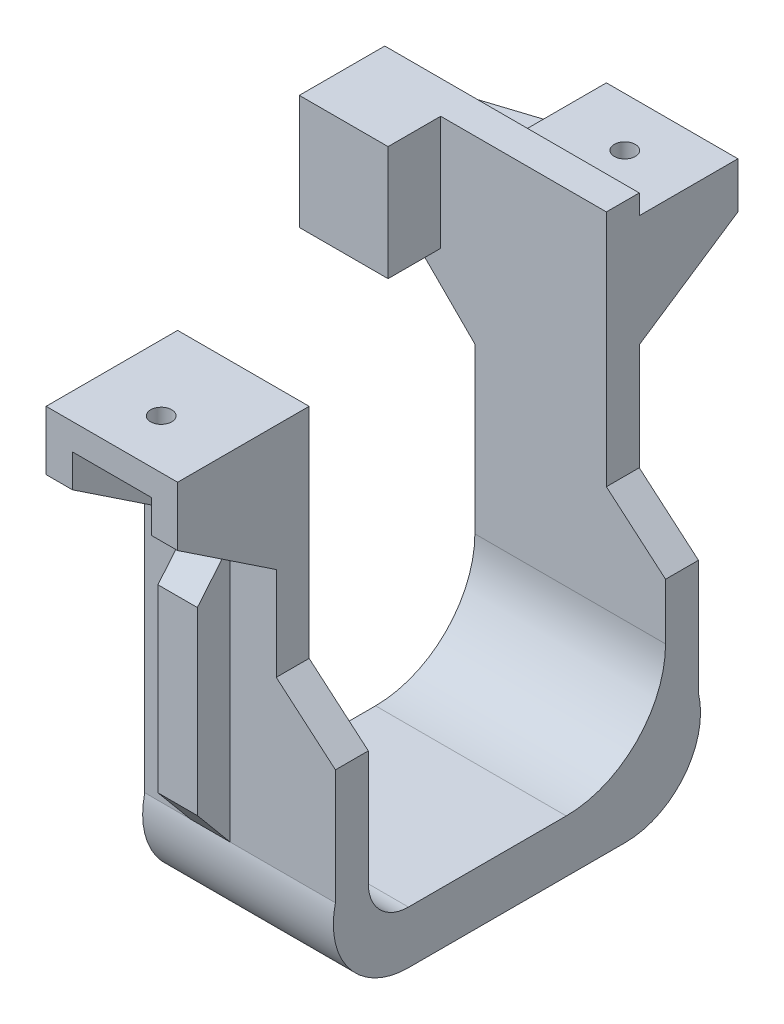
from build123d import *
from OCP.BRepFilletAPI import BRepFilletAPI_MakeChamfer

# Parameters (mm, degrees)
RESSALTO_EXTRUS_O1_DEPTH = 5
RESSALTO_EXTRUS_O2_DEPTH = 29
CORTE_EXTRUS_O1_REACH    = 89.714
RESSALTO_EXTRUS_O3_DEPTH = 5
ESBO_O5_W                = 13.5
ESBO_O5_H                = 17.397720337
RESSALTO_EXTRUS_O4_DEPTH = 8
RESSALTO_EXTRUS_O5_DEPTH = 20
ESBO_O7_W                = 11.5
ESBO_O7_H                = 13
CORTE_EXTRUS_O2_DEPTH    = 20
RESSALTO_EXTRUS_O6_DEPTH = 20
ESBO_O9_W                = 12
ESBO_O9_H                = 15
CORTE_EXTRUS_O3_DEPTH    = 20
ESBO_O11_W               = 6
ESBO_O11_H               = 39.4
RESSALTO_EXTRUS_O7_DEPTH = 5
ESBO_O12_W               = 6
ESBO_O12_H               = 41.397720337
RESSALTO_EXTRUS_O8_DEPTH = 5
CHANFRO1_SIZE            = 5
CHANFRO1_SIZE_2          = 6
RESSALTO_EXTRUS_O9_START = -5.7
RESSALTO_EXTRUS_O9_DEPTH = 6
ESBO_O14_R               = 1.6
CORTE_EXTRUS_O4_DEPTH    = 6


with BuildPart() as part:
    # Esboço1 → Ressalto-extrusão1 (new body)
    with BuildSketch(Plane.XY):
        Polygon((0, 0), (0, 58.4), (20, 58.4), (20, 25.2), (29, 17.52), (29, 0), align=None)
    extrude(amount=RESSALTO_EXTRUS_O1_DEPTH)

    # Esboço2 → Ressalto-extrusão2 (add)
    with BuildSketch(Plane.ZY):
        with BuildLine():
            Line((0, 0), (5, 0))
            ThreePointArc((5, 0), (2.871117767, -9.744454942), (-6.101940178, -14.1))
            Line((-6.101940178, -14.1), (-39.10228157, -14.1))
            ThreePointArc((-39.10228157, -14.1), (-48.076340899, -9.74361665), (-50.204561234, 0.002279663))
            Line((-50.204561234, 0.002279663), (-50.204561234, 61.4))
            Line((-50.204561234, 61.4), (-45.204561234, 61.4))
            Line((-45.204561234, 61.4), (-45.204561234, 9.002278982))
            ThreePointArc((-45.204561234, 9.002278982), (-40.78120589, -1.676645138), (-30.10228157, -6.1))
            Line((-30.10228157, -6.1), (-6.102283186, -6.1))
            ThreePointArc((-6.102283186, -6.1), (-1.788124517, -4.313489814), (0, 0))
        make_face()
    extrude(amount=-RESSALTO_EXTRUS_O2_DEPTH)

    # Esboço3 → Corte-extrusão1 (cut, up to next)
    with BuildSketch(Plane(origin=(0, 0, -50.204561234), x_dir=(-1, 0, 0), z_dir=(0, 0, -1)), mode=Mode.PRIVATE) as corte_extrus_o1_sk1:
        Polygon((-29, 17.52), (-20, 25.201139832), (-20, 61.4), (-29, 61.4), align=None)
    corte_extrus_o1_tool1 = extrude(corte_extrus_o1_sk1.sketch, amount=-CORTE_EXTRUS_O1_REACH, mode=Mode.PRIVATE) & part.part
    add(corte_extrus_o1_tool1.solids().sort_by_distance((24.64388, 41.318887, -50.204561))[0], mode=Mode.SUBTRACT)

    # Esboço4 → Ressalto-extrusão3 (add)
    with BuildSketch(Plane(origin=(0, 0, -50.204561234), x_dir=(-1, 0, 0), z_dir=(0, 0, -1))):
        Polygon((0, 34.002279663), (9.999992371, 44.002279663), (18.699996948, 44.002279663), (18.699996948, 61.4), (0, 61.4), align=None)
    extrude(amount=-RESSALTO_EXTRUS_O3_DEPTH)

    # Esboço5 → Ressalto-extrusão4 (add)
    with BuildSketch(Plane.XY.offset(-45.204561234)):
        with Locations((-11.949996948, 52.701139832)):
            Rectangle(ESBO_O5_W, ESBO_O5_H)
    extrude(amount=RESSALTO_EXTRUS_O4_DEPTH)

    # Esboço6 → Ressalto-extrusão5 (add)
    with BuildSketch(Plane(origin=(20, 0, 0), x_dir=(0, 0, -1), z_dir=(1, 0, 0))):
        Polygon((50.204561234, 58.4), (65.204561234, 58.4), (65.204561234, 51.4), (50.204561234, 41.4), align=None)
    extrude(amount=-RESSALTO_EXTRUS_O5_DEPTH)

    # Esboço7 → Corte-extrusão2 (cut)
    with BuildSketch(Plane(origin=(0, 0, -50.204561234), x_dir=(-1, 0, 0), z_dir=(0, 0, -1))):
        with Locations((-10.25, 47.9)):
            Rectangle(ESBO_O7_W, ESBO_O7_H)
    extrude(amount=CORTE_EXTRUS_O2_DEPTH, mode=Mode.SUBTRACT)

    # Esboço8 → Ressalto-extrusão6 (add)
    with BuildSketch(Plane(origin=(20, 0, 0), x_dir=(0, 0, -1), z_dir=(1, 0, 0))):
        Polygon((-5, 58.4), (-19.999999523, 58.4), (-19.999999523, 49.4), (-5, 39.4), align=None)
    extrude(amount=-RESSALTO_EXTRUS_O6_DEPTH)

    # Esboço9 → Corte-extrusão3 (cut)
    with BuildSketch(Plane.XY.offset(5)):
        with Locations((10, 46.9)):
            Rectangle(ESBO_O9_W, ESBO_O9_H)
    extrude(amount=CORTE_EXTRUS_O3_DEPTH, mode=Mode.SUBTRACT)

    # Esboço11 → Ressalto-extrusão7 (add)
    with BuildSketch(Plane.XY.offset(5)):
        with Locations((10, 19.7)):
            Rectangle(ESBO_O11_W, ESBO_O11_H)
    extrude(amount=RESSALTO_EXTRUS_O7_DEPTH)

    # Esboço12 → Ressalto-extrusão8 (add)
    with BuildSketch(Plane(origin=(0, 0, -50.204561234), x_dir=(-1, 0, 0), z_dir=(0, 0, -1))):
        with Locations((-10.25, 20.701139832)):
            Rectangle(ESBO_O12_W, ESBO_O12_H)
    extrude(amount=RESSALTO_EXTRUS_O8_DEPTH)

    # Chanfro1
    chanfro1_edges_1 = [part.edges().sort_by_distance(p)[0] for p in [
        (10, 0, 10),
    ]]
    chanfro1_side_1 = [part.faces().sort_by_distance(p)[0] for p in [
        (10, 0, 9.9),
    ]]
    chanfro1_edges_2 = [part.edges().sort_by_distance(p)[0] for p in [
        (10, 39.4, 10),
    ]]
    chanfro1_side_2 = [part.faces().sort_by_distance(p)[0] for p in [
        (10, 39.4, 9.9),
    ]]
    chanfro1_edges_3 = [part.edges().sort_by_distance(p)[0] for p in [
        (10.25, 0.002279663, -55.204561234),
    ]]
    chanfro1_side_3 = [part.faces().sort_by_distance(p)[0] for p in [
        (10.25, 0.002279663, -55.104561234),
    ]]
    chanfro1_edges_4 = [part.edges().sort_by_distance(p)[0] for p in [
        (10.25, 41.4, -55.204561234),
    ]]
    chanfro1_side_4 = [part.faces().sort_by_distance(p)[0] for p in [
        (10.25, 41.4, -55.104561234),
    ]]
    chanfro1 = BRepFilletAPI_MakeChamfer(part.part.solid().wrapped)
    for e in chanfro1_edges_1:
        chanfro1.Add(CHANFRO1_SIZE - 0.0001, CHANFRO1_SIZE_2 - 0.0001, e.wrapped, chanfro1_side_1[0].wrapped)
    for e in chanfro1_edges_2:
        chanfro1.Add(CHANFRO1_SIZE - 0.0001, CHANFRO1_SIZE_2 - 0.0001, e.wrapped, chanfro1_side_2[0].wrapped)
    for e in chanfro1_edges_3:
        chanfro1.Add(CHANFRO1_SIZE - 0.0001, CHANFRO1_SIZE_2 - 0.0001, e.wrapped, chanfro1_side_3[0].wrapped)
    for e in chanfro1_edges_4:
        chanfro1.Add(CHANFRO1_SIZE - 0.0001, CHANFRO1_SIZE_2 - 0.0001, e.wrapped, chanfro1_side_4[0].wrapped)
    add(Compound.cast(chanfro1.Shape()), mode=Mode.REPLACE)  # a hair under: the kernel refuses the full size

    # Esboço13 → Ressalto-extrusão9 (add)
    with BuildSketch(Plane(origin=(0, 61.4, 0), x_dir=(1, 0, 0), z_dir=(0, 1, 0)).offset(RESSALTO_EXTRUS_O9_START)):
        Polygon((-18.699996948, 50.204561234), (-18.699996948, 53.204561234), (0, 59.204561234), (0, 50.204561234), align=None)
    extrude(amount=-RESSALTO_EXTRUS_O9_DEPTH)

    # Esboço14 → Corte-extrusão4 (cut)
    with BuildSketch(Plane(origin=(0, 58.4, 0), x_dir=(1, 0, 0), z_dir=(0, 1, 0))):
        with Locations(Location((10.3, 57.704561234, 0), (0, 0, 270))):
            Circle(ESBO_O14_R)
        with Locations(Location((10, -12.499999523, 0), (0, 0, 270))):
            Circle(ESBO_O14_R)
    extrude(amount=-CORTE_EXTRUS_O4_DEPTH, mode=Mode.SUBTRACT)


solid = part.part
